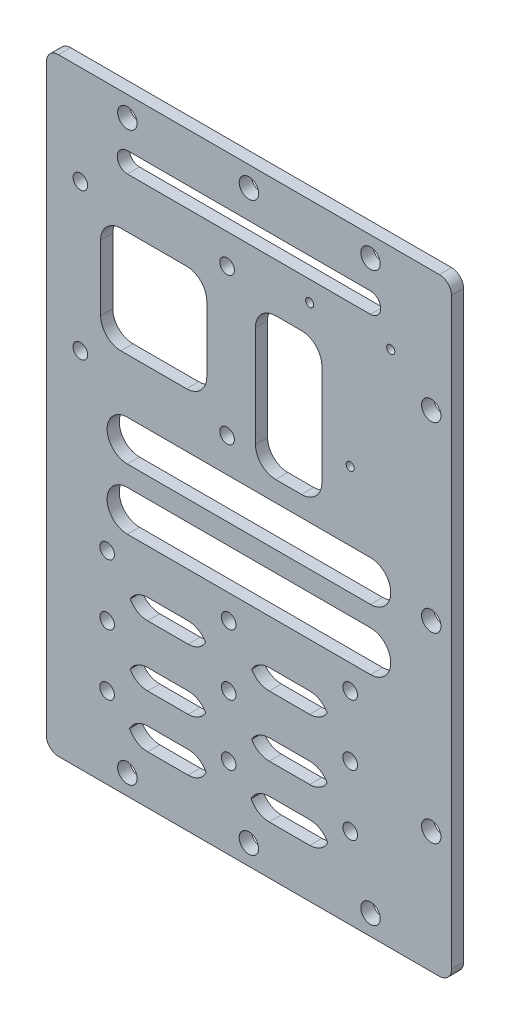
from build123d import *

# Parameters (mm, degrees)
ESQUISSE1_W             = 100
ESQUISSE1_H             = 150
BOSS_EXTRU_1_DEPTH      = 3
ESQUISSE3_R             = 2.4
ENL_V_MAT_EXTRU_2_DEPTH = 3
ESQUISSE4_R             = 1.8
ESQUISSE4_R_2           = 1
ESQUISSE4_W             = 20
ESQUISSE4_H             = 5
ESQUISSE4_W_2           = 26.2
ESQUISSE4_H_2           = 26.2
ESQUISSE4_W_3           = 16.4
ESQUISSE4_H_3           = 35
ESQUISSE4_H_4           = 5.5
ENL_V_MAT_EXTRU_3_DEPTH = 10
CONG_1_R                = 5
CONG_2_R                = 3


with BuildPart() as part:
    # Esquisse1 → Boss.-Extru.1 (new body)
    with BuildSketch(Plane.XY):
        with Locations((50, 75)):
            Rectangle(ESQUISSE1_W, ESQUISSE1_H)
    extrude(amount=BOSS_EXTRU_1_DEPTH)

    # Esquisse3 → Enlèv. mat.-Extru.2 (cut)
    with BuildSketch(Plane.XY.offset(3)):
        with Locations((20, 145)):
            Circle(ESQUISSE3_R)
        with Locations((50, 145)):
            Circle(ESQUISSE3_R)
        with Locations((80, 145)):
            Circle(ESQUISSE3_R)
        with Locations((95, 120)):
            Circle(ESQUISSE3_R)
        with Locations((95, 75)):
            Circle(ESQUISSE3_R)
        with Locations((95, 30)):
            Circle(ESQUISSE3_R)
        with Locations((80, 5)):
            Circle(ESQUISSE3_R)
        with Locations((50, 5)):
            Circle(ESQUISSE3_R)
        with Locations((20, 5)):
            Circle(ESQUISSE3_R)
    extrude(amount=-ENL_V_MAT_EXTRU_2_DEPTH, mode=Mode.SUBTRACT)

    # Esquisse4 → Enlèv. mat.-Extru.3 (cut)
    with BuildSketch(Plane.XY.offset(3)):
        with Locations((44.6, 89.4)):
            Circle(ESQUISSE4_R)
        with Locations((8.4, 125.6)):
            Circle(ESQUISSE4_R)
        with Locations((44.6, 125.6)):
            Circle(ESQUISSE4_R)
        with Locations((85, 128)):
            Circle(ESQUISSE4_R_2)
        with Locations((65, 128)):
            Circle(ESQUISSE4_R_2)
        with Locations((75, 98)):
            Circle(ESQUISSE4_R_2)
        with Locations((8.4, 89.4)):
            Circle(ESQUISSE4_R)
        with Locations((15, 50)):
            Circle(ESQUISSE4_R)
        with Locations((45, 35)):
            Circle(ESQUISSE4_R)
        with Locations((15, 20)):
            Circle(ESQUISSE4_R)
        with Locations((45, 50)):
            Circle(ESQUISSE4_R)
        with Locations((15, 35)):
            Circle(ESQUISSE4_R)
        with Locations((45, 20)):
            Circle(ESQUISSE4_R)
        with Locations((75, 20)):
            Circle(ESQUISSE4_R)
        with Locations((75, 35)):
            Circle(ESQUISSE4_R)
        with Locations((75, 50)):
            Circle(ESQUISSE4_R)
        with BuildLine():
            Line((80, 71), (20, 71))
            ThreePointArc((20, 71), (15, 76), (20, 81))
            Line((20, 81), (80, 81))
            ThreePointArc((80, 81), (85, 76), (80, 71))
        make_face()
        with Locations((30, 42.5)):
            Rectangle(ESQUISSE4_W, ESQUISSE4_H)
        with Locations((60, 42.5)):
            Rectangle(ESQUISSE4_W, ESQUISSE4_H)
        with Locations((60, 27.5)):
            Rectangle(ESQUISSE4_W, ESQUISSE4_H)
        with Locations((30, 27.5)):
            Rectangle(ESQUISSE4_W, ESQUISSE4_H)
        with Locations((26.5, 107.5)):
            Rectangle(ESQUISSE4_W_2, ESQUISSE4_H_2)
        with Locations((59.8, 103.5)):
            Rectangle(ESQUISSE4_W_3, ESQUISSE4_H_3)
        with Locations((30, 14.75)):
            Rectangle(ESQUISSE4_W, ESQUISSE4_H_4)
        with Locations((60, 14.75)):
            Rectangle(ESQUISSE4_W, ESQUISSE4_H_4)
        with BuildLine():
            Line((20, 66), (80, 66))
            ThreePointArc((80, 66), (85, 61), (80, 56))
            Line((80, 56), (20, 56))
            ThreePointArc((20, 56), (15, 61), (20, 66))
        make_face()
        with BuildLine():
            Line((20, 138), (80, 138))
            ThreePointArc((80, 138), (82.5, 135.5), (80, 133))
            Line((80, 133), (20, 133))
            ThreePointArc((20, 133), (17.5, 135.5), (20, 138))
        make_face()
    extrude(amount=-ENL_V_MAT_EXTRU_3_DEPTH, mode=Mode.SUBTRACT)

    # Congé1
    # the kernel refuses this fillet: 5 mm, written as the material it adds along each edge
    with BuildSketch(Plane(origin=(50, 25, 3), x_dir=(0, 1, 0), z_dir=(0, 0, -1)), Plane(origin=(20, 25, 3), x_dir=(0, 1, 0), z_dir=(0, 0, -1)), Plane(origin=(13.4, 94.4, 3), x_dir=(0, 1, 0), z_dir=(0, 0, -1)), Plane(origin=(50, 40, 3), x_dir=(0, 1, 0), z_dir=(0, 0, -1)), Plane(origin=(20, 40, 3), x_dir=(0, 1, 0), z_dir=(0, 0, -1)), Plane(origin=(20, 12, 3), x_dir=(0, 1, 0), z_dir=(0, 0, -1)), Plane(origin=(50, 12, 3), x_dir=(0, 1, 0), z_dir=(0, 0, -1)), Plane(origin=(68, 121, 3), x_dir=(0, -1, 0), z_dir=(0, 0, -1))) as cong_1_piece_1:
        with BuildLine():
            CenterArc((CONG_1_R, CONG_1_R), CONG_1_R, 180, 90)
            Line((0, CONG_1_R), (0, 0))
            Line((0, 0), (CONG_1_R, 0))
        make_face()
    extrude(amount=3)
    with BuildSketch(Plane(origin=(50, 45, 3), x_dir=(0, -1, 0), z_dir=(0, 0, -1)), Plane(origin=(40, 45, 3), x_dir=(-1, 0, 0), z_dir=(0, 0, -1)), Plane(origin=(40, 25, 3), x_dir=(0, 1, 0), z_dir=(0, 0, -1)), Plane(origin=(20, 45, 3), x_dir=(0, -1, 0), z_dir=(0, 0, -1)), Plane(origin=(39.6, 94.4, 3), x_dir=(0, 1, 0), z_dir=(0, 0, -1)), Plane(origin=(39.6, 120.6, 3), x_dir=(-1, 0, 0), z_dir=(0, 0, -1)), Plane(origin=(13.4, 120.6, 3), x_dir=(0, -1, 0), z_dir=(0, 0, -1)), Plane(origin=(70, 40, 3), x_dir=(0, 1, 0), z_dir=(0, 0, -1)), Plane(origin=(70, 45, 3), x_dir=(-1, 0, 0), z_dir=(0, 0, -1)), Plane(origin=(50, 30, 3), x_dir=(0, -1, 0), z_dir=(0, 0, -1)), Plane(origin=(70, 30, 3), x_dir=(-1, 0, 0), z_dir=(0, 0, -1)), Plane(origin=(70, 25, 3), x_dir=(0, 1, 0), z_dir=(0, 0, -1)), Plane(origin=(40, 40, 3), x_dir=(0, 1, 0), z_dir=(0, 0, -1)), Plane(origin=(40, 30, 3), x_dir=(-1, 0, 0), z_dir=(0, 0, -1)), Plane(origin=(20, 30, 3), x_dir=(0, -1, 0), z_dir=(0, 0, -1)), Plane(origin=(20, 17.5, 3), x_dir=(0, -1, 0), z_dir=(0, 0, -1)), Plane(origin=(40, 12, 3), x_dir=(0, 1, 0), z_dir=(0, 0, -1)), Plane(origin=(40, 17.5, 3), x_dir=(-1, 0, 0), z_dir=(0, 0, -1)), Plane(origin=(50, 17.5, 3), x_dir=(0, -1, 0), z_dir=(0, 0, -1)), Plane(origin=(70, 12, 3), x_dir=(0, 1, 0), z_dir=(0, 0, -1)), Plane(origin=(70, 17.5, 3), x_dir=(-1, 0, 0), z_dir=(0, 0, -1)), Plane(origin=(51.6, 86, 3), x_dir=(1, 0, 0), z_dir=(0, 0, -1)), Plane(origin=(68, 86, 3), x_dir=(0, 1, 0), z_dir=(0, 0, -1)), Plane(origin=(51.6, 121, 3), x_dir=(0, -1, 0), z_dir=(0, 0, -1))) as cong_1_piece_2:
        with BuildLine():
            CenterArc((CONG_1_R, -CONG_1_R), CONG_1_R, 90, 90)
            Line((0, -CONG_1_R), (0, 0))
            Line((0, 0), (CONG_1_R, 0))
        make_face()
    extrude(amount=3)

    # Congé2
    cong_2_edges = [part.edges().sort_by_distance(p)[0] for p in [
        (0, 0, 1.5),
        (0, 150, 1.5),
        (100, 150, 1.5),
        (100, 0, 1.5),
    ]]
    fillet(cong_2_edges, radius=CONG_2_R)


solid = part.part
